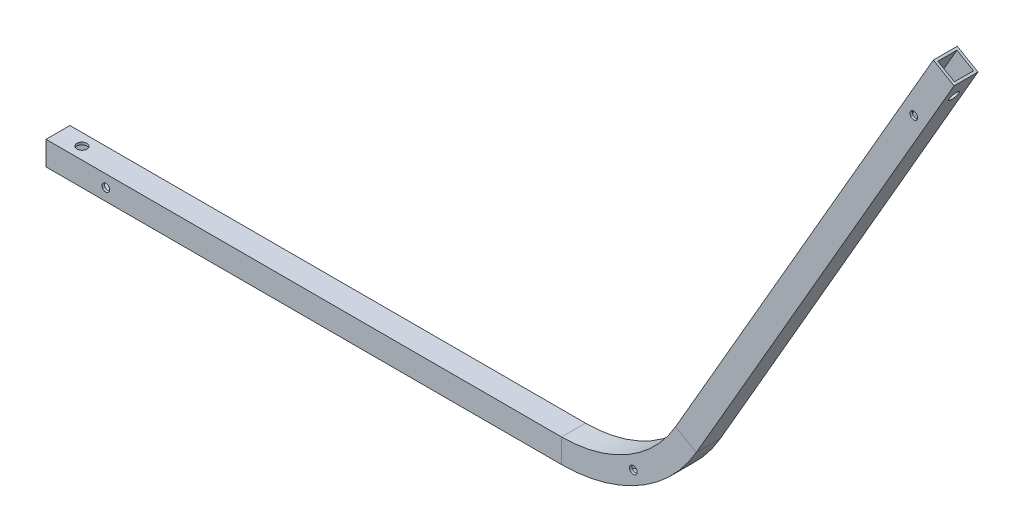
from build123d import *

# Parameters (mm, degrees)
SKETCH_3_W          = 10
SKETCH_3_H          = 10
SKETCH_3_W_2        = 8
SKETCH_3_H_2        = 8
SKETCH_5_R          = 1.6
CUT_EXTRUDE_2_DEPTH = 10
SKETCH_6_R          = 2.1
CUT_EXTRUDE_3_DEPTH = 10
SKETCH_7_R          = 2.1
CUT_EXTRUDE_4_DEPTH = 10


with BuildPart() as part:
    # ｽｲｰﾌﾟ1: sweep along a path in ｽｹｯﾁ2
    with BuildLine(Plane.XY) as sweep_1_path:
        Line((0, 0), (215.358983849, 0))
        ThreePointArc((215.358983849, 0), (245.358983849, 8.038475773), (267.320508076, 30))
        Line((267.320508076, 30), (375, 216.506350946))
    # ｽｹｯﾁ3 → ｽｲｰﾌﾟ1 (sweep)
    with BuildSketch(Plane(origin=(0, 0, 0), x_dir=(0, 0, -1), z_dir=(1, 0, 0))):
        Rectangle(SKETCH_3_W, SKETCH_3_H)
        Rectangle(SKETCH_3_W_2, SKETCH_3_H_2, mode=Mode.SUBTRACT)
    sweep(path=sweep_1_path.line)

    # ｽｹｯﾁ5 → ｶｯﾄ - 押し出し2 (cut)
    with BuildSketch(Plane.XY.offset(5)):
        with Locations((25, 0)):
            Circle(SKETCH_5_R)
        with Locations((362.5, 194.855715851)):
            Circle(SKETCH_5_R)
        with Locations((245.358983849, 8.038475773)):
            Circle(SKETCH_5_R)
    extrude(amount=-CUT_EXTRUDE_2_DEPTH, mode=Mode.SUBTRACT)

    # ｽｹｯﾁ6 → ｶｯﾄ - 押し出し3 (cut)
    with BuildSketch(Plane.XZ.offset(5)):
        with Locations((10, 0)):
            Circle(SKETCH_6_R)
    extrude(amount=-CUT_EXTRUDE_3_DEPTH, mode=Mode.SUBTRACT)

    # ｽｹｯﾁ7 → ｶｯﾄ - 押し出し4 (cut)
    with BuildSketch(Plane(origin=(191.830127019, -110.753175473, 0), x_dir=(0, 0, -1), z_dir=(0.8660254037844397, -0.499999999999998, 0))):
        with Locations((0, 365)):
            Circle(SKETCH_7_R)
    extrude(amount=-CUT_EXTRUDE_4_DEPTH, mode=Mode.SUBTRACT)


solid = part.part
